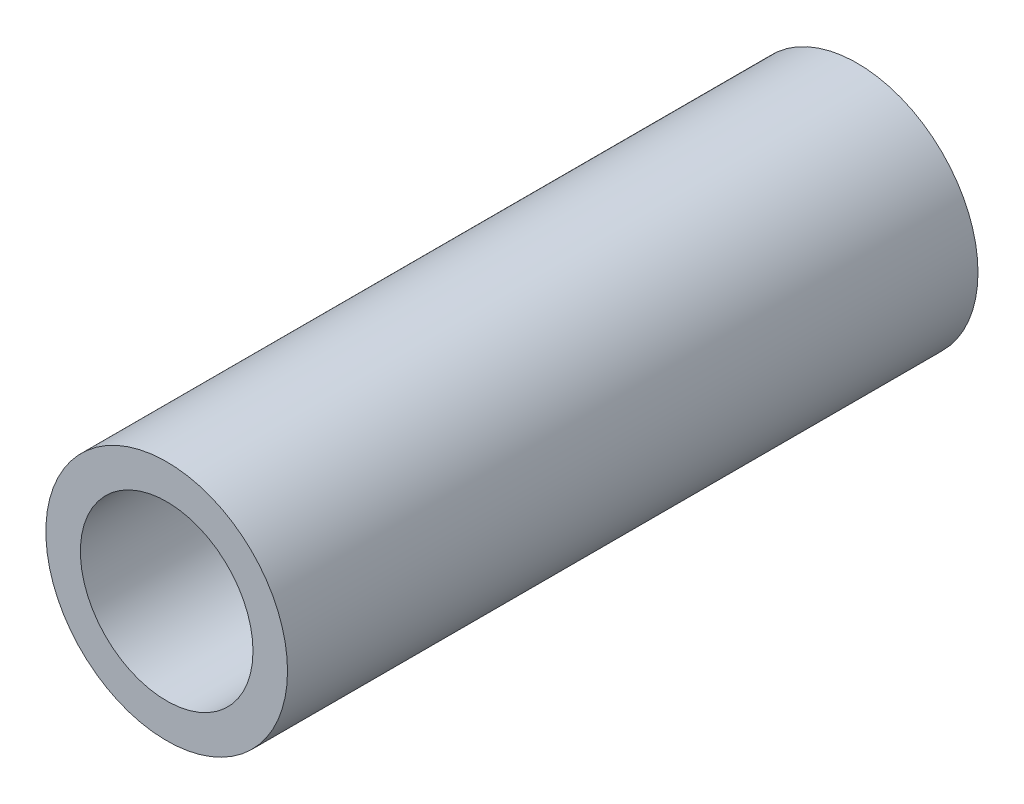
from build123d import *

# Parameters (mm, degrees)
SKETCH_1_R      = 35
SKETCH_1_R_2    = 25
EXTRUDE_1_DEPTH = 200


with BuildPart() as part:
    # 스케치1 → 보스-돌출1 (new body)
    with BuildSketch(Plane.XY):
        Circle(SKETCH_1_R)
        Circle(SKETCH_1_R_2, mode=Mode.SUBTRACT)
    extrude(amount=EXTRUDE_1_DEPTH)


solid = part.part
